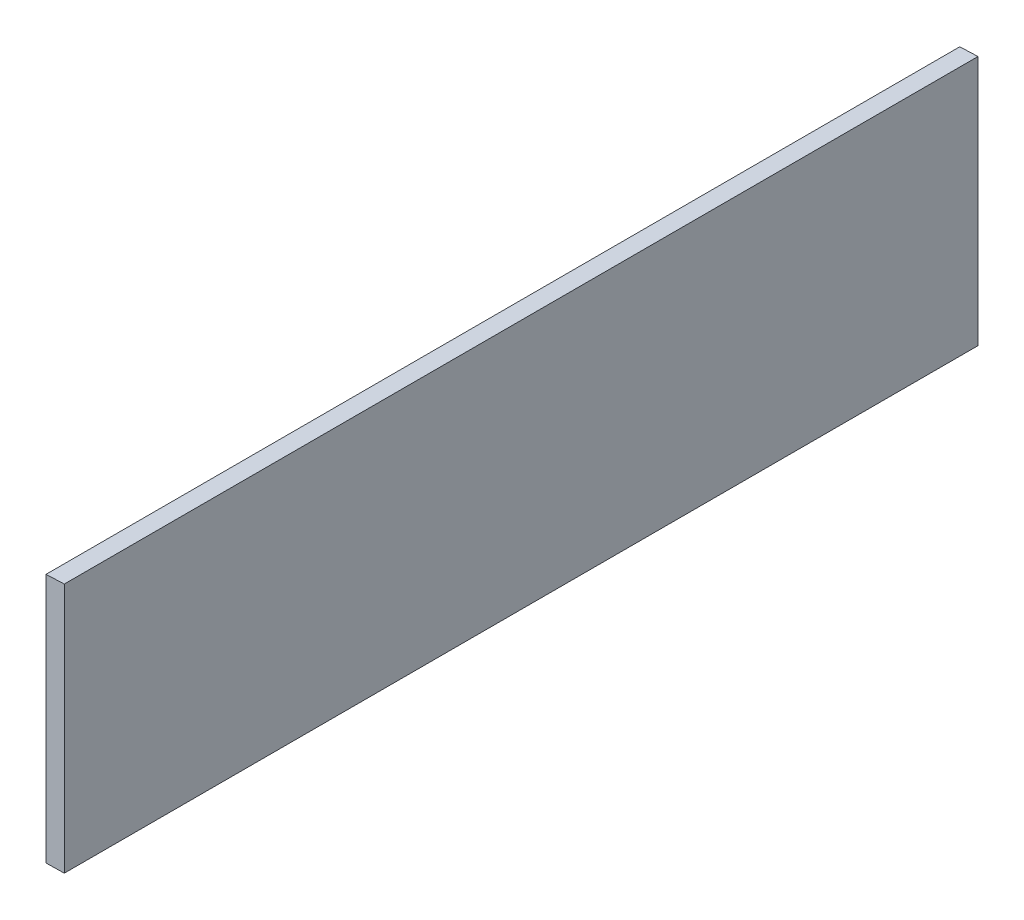
from build123d import *

# Parameters (mm, degrees)
BOSS_EXTRUDE1_DEPTH = 101.6


with BuildPart() as part:
    # Sketch1 → Boss-Extrude1 (new body)
    with BuildSketch(Plane.XY):
        with BuildLine():
            add(Edge.make_bspline(
                [(78.232, 20.905793748), (78.208970607, 20.904925511), (77.531583804, 20.879337738), (76.854248714, 20.852296647), (76.2, 20.824757853)],
                knots=[0.368781876, 0.368781876, 0.368781876, 0.368781876, 0.368893733, 0.372072045, 0.372072045, 0.372072045, 0.372072045], degree=3))
            Line((76.2, 20.824757853), (76.2, -6.975039847))
            add(Edge.make_bspline(
                [(76.2, -6.975039847), (76.348137071, -6.972691053), (76.49627378, -6.970321179), (76.644410125, -6.967930401)],
                knots=[0.629913027, 0.629913027, 0.629913027, 0.629913027, 0.630632151, 0.630632151, 0.630632151, 0.630632151], degree=3))
            add(Edge.make_bspline(
                [(76.644410125, -6.967930401), (77.173611388, -6.959389603), (77.702808019, -6.950582026), (78.232, -6.941515669)],
                knots=[0.630632151, 0.630632151, 0.630632151, 0.630632151, 0.633201144, 0.633201144, 0.633201144, 0.633201144], degree=3))
            Line((78.232, -6.941515669), (78.232, 20.905793748))
        make_face()
    extrude(amount=BOSS_EXTRUDE1_DEPTH)


solid = part.part
